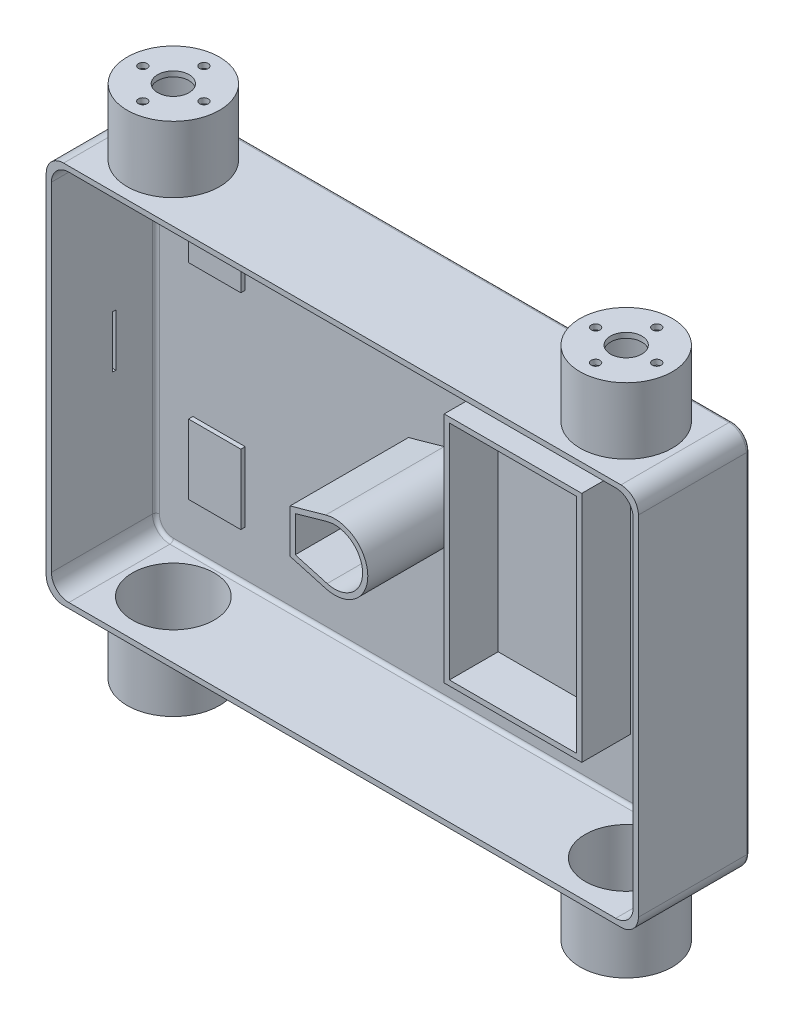
from build123d import *

# Parameters (mm, degrees)
SKETCH2_W               = 340
SKETCH2_H               = 220
BOSS_EXTRUDE1_DEPTH     = 4
SKETCH3_W               = 340
SKETCH3_H               = 220
SKETCH3_W_2             = 334
SKETCH3_H_2             = 214
BOSS_EXTRUDE2_DEPTH     = 60
FILLET1_R               = 10
FILLET2_R               = 2
FILLET3_R               = 2
CUT_EXTRUDE1_DEPTH      = 283.992932774
CUT_EXTRUDE1_DEPTH_BACK = 283.992932774
SKETCH5_R               = 10
BOSS_EXTRUDE3_DEPTH     = 15
SKETCH7_W               = 2
SKETCH7_H               = 30
CUT_EXTRUDE3_DEPTH      = 30
DELETEFACE1_START       = -110
DELETEFACE1_OUTLINE_R   = 10
DELETEFACE1_DEPTH       = 3
DELETEFACE2_START       = 107
DELETEFACE2_OUTLINE_R   = 10
DELETEFACE2_DEPTH       = 3
DELETEFACE2_START_2     = -110
DELETEFACE2_2_OUTLINE_R = 10
DELETEFACE2_2_DEPTH     = 3
CUT_EXTRUDE6_DEPTH      = 287.152668575
CUT_EXTRUDE6_DEPTH_BACK = 287.152668575
SKETCH11_R              = 23.5
CUT_EXTRUDE7_DEPTH      = 287.152668575
CUT_EXTRUDE7_DEPTH_BACK = 287.152668575
SKETCH14_R              = 23.5
SKETCH15_R              = 26.5
SKETCH15_R_2            = 23.5
BOSS_EXTRUDE5_DEPTH     = 35
SKETCH16_R              = 26.5
BOSS_EXTRUDE6_DEPTH     = 3
SKETCH17_R              = 26.5
BOSS_EXTRUDE7_DEPTH     = 3
CUT_EXTRUDE8_REACH      = 320.368
SKETCH18_R              = 9
CUT_EXTRUDE9_REACH      = 349.338
SKETCH20_R              = 2.5
MIRROR3_COPY_1_REACH    = 349.338
MIRROR3_COPY_1_SKETCH_R = 2.5
SKETCH21_W              = 30
SKETCH21_H              = 40
BOSS_EXTRUDE8_DEPTH     = 2.5
SKETCH34_W              = 79
SKETCH34_H              = 133.79
SKETCH34_W_2            = 73
SKETCH34_H_2            = 127.79
CUT_EXTRUDE19_DEPTH     = 2
SKETCH35_W              = 79
SKETCH35_H              = 133.79
SKETCH35_W_2            = 73
SKETCH35_H_2            = 127.79
BOSS_EXTRUDE9_DEPTH     = 30
CUT_EXTRUDE20_DEPTH     = 2
BOSS_EXTRUDE10_START    = 70
BOSS_EXTRUDE10_DEPTH    = 70
SKETCH38_R              = 13.05
CUT_EXTRUDE21_DEPTH     = 4


# Read off the part's stored shape, not the designer's step: DeleteFace1, DeleteFace2
with BuildPart() as part:
    # Sketch2 → Boss-Extrude1 (new body)
    with BuildSketch(Plane.XY):
        Rectangle(SKETCH2_W, SKETCH2_H)
    extrude(amount=BOSS_EXTRUDE1_DEPTH)

    # Sketch3 → Boss-Extrude2 (add)
    with BuildSketch(Plane.XY.offset(4)):
        Rectangle(SKETCH3_W, SKETCH3_H)
        Rectangle(SKETCH3_W_2, SKETCH3_H_2, mode=Mode.SUBTRACT)
    extrude(amount=BOSS_EXTRUDE2_DEPTH)

    # Fillet1
    fillet1_edges = [part.edges().sort_by_distance(p)[0] for p in [
        (-167, 107, 34),
        (-167, -107, 34),
        (167, -107, 34),
        (167, 107, 34),
        (-170, 110, 32),
        (-170, -110, 32),
        (170, -110, 32),
        (170, 110, 32),
    ]]
    fillet(fillet1_edges, radius=FILLET1_R)

    # Fillet2
    fillet2_edges = [part.edges().sort_by_distance(p)[0] for p in [
        (-170, 0, 0),
        (0, 110, 0),
        (170, 0, 0),
        (0, -110, 0),
        (-167.071067812, -107.071067812, 0),
        (167.071067812, -107.071067812, 0),
        (167.071067812, 107.071067812, 0),
        (-167.071067812, 107.071067812, 0),
    ]]
    fillet(fillet2_edges, radius=FILLET2_R)

    # Fillet3
    fillet3_edges = [part.edges().sort_by_distance(p)[0] for p in [
        (167, 0, 4),
        (0, 107, 4),
        (-167, 0, 4),
        (0, -107, 4),
        (-164.071067812, -104.071067812, 4),
        (-164.071067812, 104.071067812, 4),
        (164.071067812, -104.071067812, 4),
        (164.071067812, 104.071067812, 4),
    ]]
    fillet(fillet3_edges, radius=FILLET3_R)

    # Sketch5 → Cut-Extrude1 (cut, two sides: drawn at the far end of the back side and taken through both)
    with BuildSketch(Plane.XZ.offset(-107).offset(-CUT_EXTRUDE1_DEPTH_BACK)):
        with Locations(Location((-142, 18, 0), (0, 0, 270))):
            Circle(SKETCH5_R)
        with Locations(Location((142, 18, 0), (0, 0, 270))):
            Circle(SKETCH5_R)
    extrude(amount=CUT_EXTRUDE1_DEPTH + CUT_EXTRUDE1_DEPTH_BACK, mode=Mode.SUBTRACT)

    # Sketch6 → Boss-Extrude3 (add, symmetric)
    with BuildSketch(Plane(origin=(0, 0, 0), x_dir=(1, 0, 0), z_dir=(0, 1, 0))):
        Polygon((-170, -17), (-175.20944533, -46.54423259), (-170, -46.54423259), align=None)
    extrude(amount=BOSS_EXTRUDE3_DEPTH, both=True)

    # Sketch7 → Cut-Extrude3 (cut)
    with BuildSketch(Plane(origin=(-167, 0, 0), x_dir=(0, 0, -1), z_dir=(1, 0, 0))):
        with Locations((-28, 0)):
            Rectangle(SKETCH7_W, SKETCH7_H)
    extrude(amount=-CUT_EXTRUDE3_DEPTH, mode=Mode.SUBTRACT)

    # DeleteFace1 outline → DeleteFace1 (add)
    with BuildSketch(Plane(origin=(0, 0, 0), x_dir=(1, 0, 0), z_dir=(0, 1, 0)).offset(DELETEFACE1_START)):
        with Locations((142, -18)):
            Circle(DELETEFACE1_OUTLINE_R)
    extrude(amount=DELETEFACE1_DEPTH)

    # DeleteFace2 outline → DeleteFace2 (add)
    with BuildSketch(Plane(origin=(0, 0, 0), x_dir=(1, 0, 0), z_dir=(0, 1, 0)).offset(DELETEFACE2_START)):
        with Locations((-142, -18)):
            Circle(DELETEFACE2_OUTLINE_R)
        with Locations((142, -18)):
            Circle(DELETEFACE2_OUTLINE_R)
    extrude(amount=DELETEFACE2_DEPTH)

    # DeleteFace2 2 outline → DeleteFace2 2 (add)
    with BuildSketch(Plane(origin=(0, 0, 0), x_dir=(1, 0, 0), z_dir=(0, 1, 0)).offset(DELETEFACE2_START_2)):
        with Locations((-142, -18)):
            Circle(DELETEFACE2_2_OUTLINE_R)
    extrude(amount=DELETEFACE2_2_DEPTH)

    # Sketch11 → Cut-Extrude6 (cut, two sides: drawn at the far end of the back side and taken through both)
    with BuildSketch(Plane(origin=(0, -107, 0), x_dir=(1, 0, 0), z_dir=(0, 1, 0)).offset(-CUT_EXTRUDE6_DEPTH_BACK)):
        with Locations(Location((130, -31, 0), (0, 0, 180))):
            Circle(SKETCH11_R)
    extrude(amount=CUT_EXTRUDE6_DEPTH + CUT_EXTRUDE6_DEPTH_BACK, mode=Mode.SUBTRACT)

    # Sketch14 → Cut-Extrude7 (cut, two sides: drawn at the far end of the back side and taken through both)
    with BuildSketch(Plane(origin=(0, -107, 0), x_dir=(1, 0, 0), z_dir=(0, 1, 0)).offset(-CUT_EXTRUDE7_DEPTH_BACK)):
        with Locations(Location((-130, -31, 0), (0, 0, 180))):
            Circle(SKETCH14_R)
    extrude(amount=CUT_EXTRUDE7_DEPTH + CUT_EXTRUDE7_DEPTH_BACK, mode=Mode.SUBTRACT)

    # Sketch15 → Boss-Extrude5 (add)
    # profile 1 of 2: a face of its own
    with BuildSketch(Plane.XZ.offset(110)):
        with Locations(Location((-130, 31, 0), (0, 0, 90))):
            Circle(SKETCH15_R)
        with Locations(Location((-130, 31, 0), (0, 0, 180))):
            Circle(SKETCH15_R_2, mode=Mode.SUBTRACT)
    # profile 2 of 2: a face of its own
    with BuildSketch(Plane.XZ.offset(110)):
        with Locations(Location((130, 31, 0), (0, 0, 90))):
            Circle(SKETCH15_R)
        with Locations(Location((130, 31, 0), (0, 0, 180))):
            Circle(SKETCH15_R_2, mode=Mode.SUBTRACT)
    boss_extrude5 = extrude(amount=BOSS_EXTRUDE5_DEPTH)

    # Sketch16 → Boss-Extrude6 (add)
    with BuildSketch(Plane.XZ.offset(145)):
        with Locations(Location((-130, 31, 0), (0, 0, 90))):
            Circle(SKETCH16_R)
    boss_extrude6 = extrude(amount=BOSS_EXTRUDE6_DEPTH)

    # Sketch17 → Boss-Extrude7 (add)
    with BuildSketch(Plane.XZ.offset(145)):
        with Locations(Location((130, 31, 0), (0, 0, 90))):
            Circle(SKETCH17_R)
    boss_extrude7 = extrude(amount=BOSS_EXTRUDE7_DEPTH)

    # Sketch18 → Cut-Extrude8 (cut, up to next)
    with BuildSketch(Plane.XZ.offset(148), mode=Mode.PRIVATE) as cut_extrude8_sk1:
        with Locations(Location((-130, 31, 0), (0, 0, 270))):
            Circle(SKETCH18_R)
    cut_extrude8_tool1 = extrude(cut_extrude8_sk1.sketch, amount=-CUT_EXTRUDE8_REACH, mode=Mode.PRIVATE) & part.part
    # Sketch18 → Cut-Extrude8 (cut, up to next)
    with BuildSketch(Plane.XZ.offset(148), mode=Mode.PRIVATE) as cut_extrude8_sk2:
        with Locations(Location((130, 31, 0), (0, 0, 270))):
            Circle(SKETCH18_R)
    cut_extrude8_tool2 = extrude(cut_extrude8_sk2.sketch, amount=-CUT_EXTRUDE8_REACH, mode=Mode.PRIVATE) & part.part
    cut_extrude8_1 = cut_extrude8_tool1.solids().sort_by_distance((-130, -148, 31))[0]
    add(cut_extrude8_1, mode=Mode.SUBTRACT)
    cut_extrude8_2 = cut_extrude8_tool2.solids().sort_by_distance((130, -148, 31))[0]
    add(cut_extrude8_2, mode=Mode.SUBTRACT)
    cut_extrude8 = cut_extrude8_1 + cut_extrude8_2  # Cut-Extrude8 as one shape, for the pattern or mirror that repeats it

    # Mirror1: Boss-Extrude5, Boss-Extrude6, Boss-Extrude7, Cut-Extrude8 across plane
    add(boss_extrude5.mirror(Plane.ZX))
    add(boss_extrude6.mirror(Plane.ZX))
    add(boss_extrude7.mirror(Plane.ZX))
    add(cut_extrude8.mirror(Plane.ZX), mode=Mode.SUBTRACT)

    # Sketch20 → Cut-Extrude9 (cut, up to next)
    with BuildSketch(Plane.XZ.offset(-145), mode=Mode.PRIVATE) as cut_extrude9_sk1:
        with Locations(Location((-130, 48.55, 0), (0, 0, 270))):
            Circle(SKETCH20_R)
    cut_extrude9_tool1 = extrude(cut_extrude9_sk1.sketch, amount=-CUT_EXTRUDE9_REACH, mode=Mode.PRIVATE) & part.part
    # Sketch20 → Cut-Extrude9 (cut, up to next)
    with BuildSketch(Plane.XZ.offset(-145), mode=Mode.PRIVATE) as cut_extrude9_sk2:
        with Locations(Location((-112.45, 31, 0), (0, 0, 270))):
            Circle(SKETCH20_R)
    cut_extrude9_tool2 = extrude(cut_extrude9_sk2.sketch, amount=-CUT_EXTRUDE9_REACH, mode=Mode.PRIVATE) & part.part
    # Sketch20 → Cut-Extrude9 (cut, up to next)
    with BuildSketch(Plane.XZ.offset(-145), mode=Mode.PRIVATE) as cut_extrude9_sk3:
        with Locations(Location((-130, 13.45, 0), (0, 0, 270))):
            Circle(SKETCH20_R)
    cut_extrude9_tool3 = extrude(cut_extrude9_sk3.sketch, amount=-CUT_EXTRUDE9_REACH, mode=Mode.PRIVATE) & part.part
    # Sketch20 → Cut-Extrude9 (cut, up to next)
    with BuildSketch(Plane.XZ.offset(-145), mode=Mode.PRIVATE) as cut_extrude9_sk4:
        with Locations(Location((-147.55, 31, 0), (0, 0, 270))):
            Circle(SKETCH20_R)
    cut_extrude9_tool4 = extrude(cut_extrude9_sk4.sketch, amount=-CUT_EXTRUDE9_REACH, mode=Mode.PRIVATE) & part.part
    cut_extrude9_1 = cut_extrude9_tool1.solids().sort_by_distance((-130, 145, 48.55))[0]
    add(cut_extrude9_1, mode=Mode.SUBTRACT)
    cut_extrude9_2 = cut_extrude9_tool2.solids().sort_by_distance((-112.45, 145, 31))[0]
    add(cut_extrude9_2, mode=Mode.SUBTRACT)
    cut_extrude9_3 = cut_extrude9_tool3.solids().sort_by_distance((-130, 145, 13.45))[0]
    add(cut_extrude9_3, mode=Mode.SUBTRACT)
    cut_extrude9_4 = cut_extrude9_tool4.solids().sort_by_distance((-147.55, 145, 31))[0]
    add(cut_extrude9_4, mode=Mode.SUBTRACT)
    cut_extrude9 = cut_extrude9_1 + cut_extrude9_2 + cut_extrude9_3 + cut_extrude9_4  # Cut-Extrude9 as one shape, for the pattern or mirror that repeats it

    # Mirror2: Cut-Extrude9 across plane
    add(cut_extrude9.mirror(Plane(origin=(0, 0, 0), x_dir=(0, 0, 1), z_dir=(1, 0, 0))), mode=Mode.SUBTRACT)

    # Mirror3: Cut-Extrude9 across plane
    add(cut_extrude9.mirror(Plane.ZX), mode=Mode.SUBTRACT)

    # Mirror3 copy 1 sketch → Mirror3 copy 1 (cut, up to next)
    with BuildSketch(Plane(origin=(0, -145, 0), x_dir=(-1, 0, 0), z_dir=(0, 1, 0)), mode=Mode.PRIVATE) as mirror3_copy_1_sk1:
        with Locations(Location((-130, 48.55, 0), (0, 0, 270))):
            Circle(MIRROR3_COPY_1_SKETCH_R)
    mirror3_copy_1_tool1 = extrude(mirror3_copy_1_sk1.sketch, amount=-MIRROR3_COPY_1_REACH, mode=Mode.PRIVATE) & part.part
    # Mirror3 copy 1 sketch → Mirror3 copy 1 (cut, up to next)
    with BuildSketch(Plane(origin=(0, -145, 0), x_dir=(-1, 0, 0), z_dir=(0, 1, 0)), mode=Mode.PRIVATE) as mirror3_copy_1_sk2:
        with Locations(Location((-112.45, 31, 0), (0, 0, 270))):
            Circle(MIRROR3_COPY_1_SKETCH_R)
    mirror3_copy_1_tool2 = extrude(mirror3_copy_1_sk2.sketch, amount=-MIRROR3_COPY_1_REACH, mode=Mode.PRIVATE) & part.part
    # Mirror3 copy 1 sketch → Mirror3 copy 1 (cut, up to next)
    with BuildSketch(Plane(origin=(0, -145, 0), x_dir=(-1, 0, 0), z_dir=(0, 1, 0)), mode=Mode.PRIVATE) as mirror3_copy_1_sk3:
        with Locations(Location((-130, 13.45, 0), (0, 0, 270))):
            Circle(MIRROR3_COPY_1_SKETCH_R)
    mirror3_copy_1_tool3 = extrude(mirror3_copy_1_sk3.sketch, amount=-MIRROR3_COPY_1_REACH, mode=Mode.PRIVATE) & part.part
    # Mirror3 copy 1 sketch → Mirror3 copy 1 (cut, up to next)
    with BuildSketch(Plane(origin=(0, -145, 0), x_dir=(-1, 0, 0), z_dir=(0, 1, 0)), mode=Mode.PRIVATE) as mirror3_copy_1_sk4:
        with Locations(Location((-147.55, 31, 0), (0, 0, 270))):
            Circle(MIRROR3_COPY_1_SKETCH_R)
    mirror3_copy_1_tool4 = extrude(mirror3_copy_1_sk4.sketch, amount=-MIRROR3_COPY_1_REACH, mode=Mode.PRIVATE) & part.part
    add(mirror3_copy_1_tool1.solids().sort_by_distance((130, -145, 48.55))[0], mode=Mode.SUBTRACT)
    add(mirror3_copy_1_tool2.solids().sort_by_distance((112.45, -145, 31))[0], mode=Mode.SUBTRACT)
    add(mirror3_copy_1_tool3.solids().sort_by_distance((130, -145, 13.45))[0], mode=Mode.SUBTRACT)
    add(mirror3_copy_1_tool4.solids().sort_by_distance((147.55, -145, 31))[0], mode=Mode.SUBTRACT)

    # Sketch21 → Boss-Extrude8 (add)
    with BuildSketch(Plane.XY.offset(4)):
        with Locations((130.752728902, 58.87689806)):
            Rectangle(SKETCH21_W, SKETCH21_H)
        with Locations((130.752728902, -58.87689806)):
            Rectangle(SKETCH21_W, SKETCH21_H)
        with Locations((-130.752728902, -58.87689806)):
            Rectangle(SKETCH21_W, SKETCH21_H)
        with Locations((-130.752728902, 58.87689806)):
            Rectangle(SKETCH21_W, SKETCH21_H)
    extrude(amount=BOSS_EXTRUDE8_DEPTH)

    # Sketch34 → Cut-Extrude19 (cut)
    with BuildSketch(Plane(origin=(16.190785204, -13.966786582, 4), x_dir=(1, 0, 0), z_dir=(0, 0, 1))):
        with Locations((49.809214796, 9.606286582)):
            Rectangle(SKETCH34_W, SKETCH34_H)
        with Locations((49.809214796, 9.606286582)):
            Rectangle(SKETCH34_W_2, SKETCH34_H_2, mode=Mode.SUBTRACT)
    extrude(amount=-CUT_EXTRUDE19_DEPTH, mode=Mode.SUBTRACT)

    # Sketch35 → Boss-Extrude9 (add)
    with BuildSketch(Plane.XY.offset(2)):
        with Locations((66, -4.3605)):
            Rectangle(SKETCH35_W, SKETCH35_H)
        with Locations((66, -4.3605)):
            Rectangle(SKETCH35_W_2, SKETCH35_H_2, mode=Mode.SUBTRACT)
    extrude(amount=BOSS_EXTRUDE9_DEPTH)

    # Sketch36 → Cut-Extrude20 (cut)
    with BuildSketch(Plane(origin=(16.190785204, -13.966786582, 4), x_dir=(1, 0, 0), z_dir=(0, 0, 1))):
        with BuildLine():
            Line((-38.190785204, 1.435418015), (-17.678118315, -4.325501642))
            ThreePointArc((-17.678118315, -4.325501642), (6.459214796, 13.966786582), (-17.678118315, 32.259074807))
            Line((-17.678118315, 32.259074807), (-38.190785204, 26.49815515))
            Line((-38.190785204, 26.49815515), (-38.190785204, 1.435418015))
        make_face()
        with BuildLine():
            Line((-16.866960456, 29.370818772), (-35.190785204, 24.224628724))
            Line((-35.190785204, 24.224628724), (-35.190785204, 3.708944441))
            Line((-35.190785204, 3.708944441), (-16.866960456, -1.437245607))
            ThreePointArc((-16.866960456, -1.437245607), (3.459214796, 13.966786582), (-16.866960456, 29.370818772))
        make_face(mode=Mode.SUBTRACT)
    extrude(amount=-CUT_EXTRUDE20_DEPTH, mode=Mode.SUBTRACT)

    # Sketch37 → Boss-Extrude10 (add)
    with BuildSketch(Plane.XY.offset(2).offset(BOSS_EXTRUDE10_START)):
        with BuildLine():
            Line((-22, 12.531368568), (-22, -12.531368568))
            Line((-22, -12.531368568), (-1.487333111, -18.292288225))
            ThreePointArc((-1.487333111, -18.292288225), (22.65, 0), (-1.487333111, 18.292288225))
            Line((-1.487333111, 18.292288225), (-22, 12.531368568))
        make_face()
        with BuildLine():
            Line((-19, -10.257842142), (-0.676175252, -15.404032189))
            ThreePointArc((-0.676175252, -15.404032189), (19.65, 0), (-0.676175252, 15.404032189))
            Line((-0.676175252, 15.404032189), (-19, 10.257842142))
            Line((-19, 10.257842142), (-19, -10.257842142))
        make_face(mode=Mode.SUBTRACT)
    extrude(amount=-BOSS_EXTRUDE10_DEPTH)

    # Sketch38 → Cut-Extrude21 (cut)
    with BuildSketch(Plane(origin=(16.190785204, -13.966786582, 0), x_dir=(-1, 0, 0), z_dir=(0, 0, -1))):
        with Locations((12.540785204, 13.966786582)):
            Circle(SKETCH38_R)
    extrude(amount=-CUT_EXTRUDE21_DEPTH, mode=Mode.SUBTRACT)


solid = part.part
